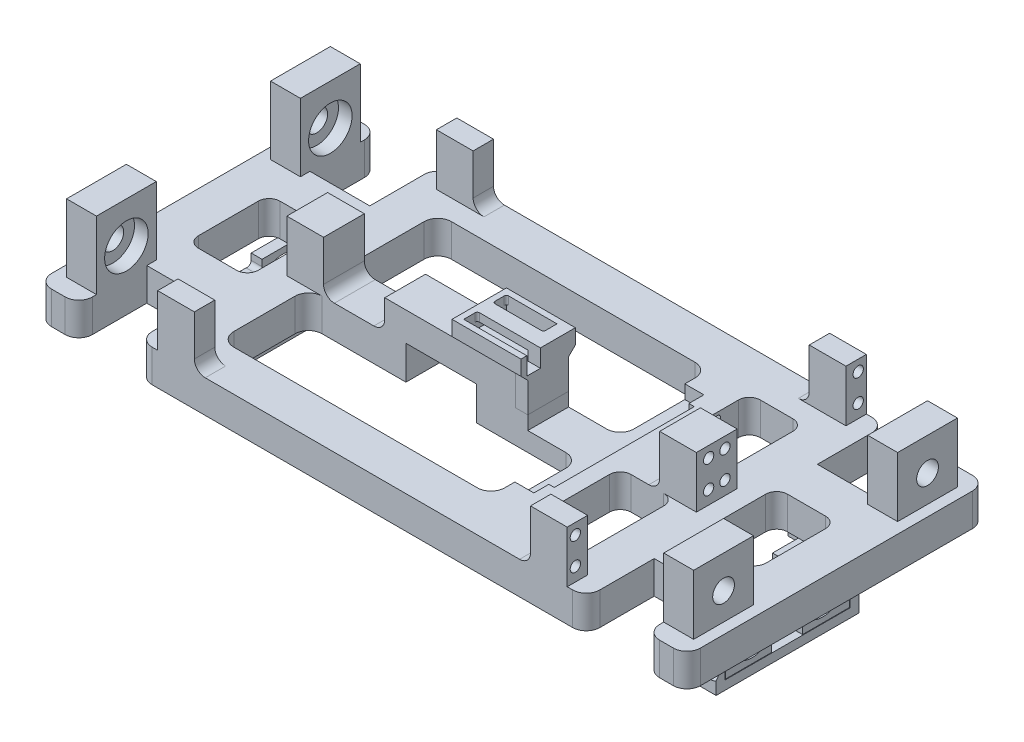
from build123d import *

# Parameters (mm, degrees)
SKETCH1_W             = 134.6
SKETCH1_H             = 32.5
BOSS_EXTRUDE1_DEPTH   = 12
SKETCH2_W             = 12
SKETCH2_H             = 7.5
BOSS_EXTRUDE2_DEPTH   = 19
SKETCH3_R             = 1.9
CUT_EXTRUDE1_DEPTH    = 205.585336718
SKETCH4_W             = 22
SKETCH4_H             = 22
SKETCH4_R             = 8
BOSS_EXTRUDE3_DEPTH   = 5
BOSS_EXTRUDE3_2_DEPTH = 5
SKETCH6_W             = 22
SKETCH6_H             = 22
SKETCH6_R             = 4
BOSS_EXTRUDE4_DEPTH   = 6
SKETCH7_W             = 22
SKETCH7_H             = 15
BOSS_EXTRUDE5_DEPTH   = 12
SKETCH8_W             = 22
SKETCH8_H             = 30
CUT_EXTRUDE2_DEPTH    = 134.197184655
SKETCH14_W            = 15
SKETCH14_H            = 32.5
BOSS_EXTRUDE8_DEPTH   = 12
SKETCH16_W            = 15
SKETCH16_H            = 32.5
CUT_EXTRUDE8_DEPTH    = 134.197184655
SKETCH17_W            = 15
SKETCH17_H            = 32.5
BOSS_EXTRUDE9_DEPTH   = 12
SKETCH15_W            = 26
SKETCH15_H            = 62.5
CUT_EXTRUDE9_DEPTH    = 5
CUT_EXTRUDE10_REACH   = 173.275
SKETCH18_R            = 1.2
SKETCH19_W            = 51.5
SKETCH19_H            = 7
CUT_EXTRUDE11_DEPTH   = 2
BOSS_EXTRUDE10_DEPTH  = 15
SKETCH22_W            = 4.6
SKETCH22_H            = 11
BOSS_EXTRUDE11_DEPTH  = 15
BOSS_EXTRUDE12_DEPTH  = 4.6
BOSS_EXTRUDE13_DEPTH  = 18.6
SKETCH29_W            = 20
SKETCH29_H            = 5.5
BOSS_EXTRUDE14_DEPTH  = 2.15
CUT_EXTRUDE12_DEPTH   = 135.318613751
SKETCH41_W            = 3
SKETCH41_H            = 3.5
SKETCH41_H_2          = 7.75
SKETCH41_H_3          = 30
BOSS_EXTRUDE18_DEPTH  = 24
BOSS_EXTRUDE19_DEPTH  = 8
SKETCH44_W            = 7.5
SKETCH44_H            = 5
BOSS_EXTRUDE20_DEPTH  = 7.5
SKETCH45_R            = 2.75
CUT_EXTRUDE20_DEPTH   = 3
SKETCH47_R            = 1.4
CUT_EXTRUDE22_DEPTH   = 10
BOSS_EXTRUDE22_START  = 5
SKETCH48_R            = 8.1
BOSS_EXTRUDE22_DEPTH  = 4
SKETCH50_W            = 26
SKETCH50_H            = 2.2
SKETCH50_H_2          = 12.8
CUT_EXTRUDE23_DEPTH   = 11
SKETCH53_R            = 1.4
CUT_EXTRUDE26_DEPTH   = 8.6
SKETCH55_W            = 1.5
SKETCH55_H            = 7.5
SKETCH55_H_2          = 15
BOSS_EXTRUDE27_DEPTH  = 19
CUT_EXTRUDE27_DEPTH   = 3
SKETCH56_R            = 1.45
CUT_EXTRUDE28_DEPTH   = 5
SKETCH57_R            = 1.45
CUT_EXTRUDE29_DEPTH   = 5
CHAMFER1_SIZE         = 2
SKETCH58_R            = 1.4
CUT_EXTRUDE30_DEPTH   = 10
SKETCH59_W            = 26
SKETCH59_H            = 2.2
CUT_EXTRUDE31_DEPTH   = 1.4
SKETCH60_W            = 11
SKETCH60_H            = 22
BOSS_EXTRUDE28_DEPTH  = 3
SKETCH62_R            = 1.825
CUT_EXTRUDE33_DEPTH   = 9
FILLET2_R             = 4
FILLET4_R             = 5
SKETCH64_W            = 4.6
SKETCH64_H            = 5
CUT_EXTRUDE34_DEPTH   = 3.5


with BuildPart() as part:
    # Sketch1 → Boss-Extrude1 (new body)
    with BuildSketch(Plane(origin=(0, 0, 0), x_dir=(1, 0, 0), z_dir=(0, 1, 0))):
        Polygon((-104.3, -55), (-104.3, -7.5), (-82.3, -7.5), (-82.3, -55), (82.3, -55), (82.3, -7.5), (104.3, -7.5), (104.3, -55), (119.3, -55), (119.3, 55), (104.3, 55), (104.3, 7.5), (82.3, 7.5), (82.3, 55), (-82.3, 55), (-82.3, 7.5), (-104.3, 7.5), (-104.3, 55), (-119.3, 55), (-119.3, -55), align=None)
        with Locations((0, -23.75)):
            Rectangle(SKETCH1_W, SKETCH1_H, mode=Mode.SUBTRACT)
        with Locations((0, 23.75)):
            Rectangle(SKETCH1_W, SKETCH1_H, mode=Mode.SUBTRACT)
    extrude(amount=BOSS_EXTRUDE1_DEPTH)

    # Sketch2 → Boss-Extrude2 (add)
    with BuildSketch(Plane(origin=(0, 12, 0), x_dir=(1, 0, 0), z_dir=(0, 1, 0))):
        with Locations((-69.3, 51.25)):
            Rectangle(SKETCH2_W, SKETCH2_H)
        Polygon((-75.3, 7.5), (-63.3, 7.5), (-63.3, 0), (-63.3, -7.5), (-75.3, -7.5), (-75.3, 0), align=None)
        with Locations((-69.3, -51.25)):
            Rectangle(SKETCH2_W, SKETCH2_H)
        with Locations((69.3, -51.25)):
            Rectangle(SKETCH2_W, SKETCH2_H)
        Polygon((75.3, 7.5), (75.3, 0), (75.3, -7.5), (63.3, -7.5), (63.3, 0), (63.3, 7.5), align=None)
        with Locations((69.3, 51.25)):
            Rectangle(SKETCH2_W, SKETCH2_H)
    extrude(amount=BOSS_EXTRUDE2_DEPTH)

    # Sketch3 → Cut-Extrude1 (cut, through all)
    with BuildSketch(Plane.ZY.offset(75.3)):
        with Locations((-52, 17)):
            Circle(SKETCH3_R)
        with Locations((-52, 27)):
            Circle(SKETCH3_R)
        with Locations((-3, 17)):
            Circle(SKETCH3_R)
        with Locations((-3, 27)):
            Circle(SKETCH3_R)
        with Locations((3, 27)):
            Circle(SKETCH3_R)
        with Locations((3, 17)):
            Circle(SKETCH3_R)
        with Locations((52, 17)):
            Circle(SKETCH3_R)
        with Locations((52, 27)):
            Circle(SKETCH3_R)
    extrude(amount=-CUT_EXTRUDE1_DEPTH, mode=Mode.SUBTRACT)



with BuildPart() as body_2:
    # Sketch4 → Boss-Extrude3 (new body)
    with BuildSketch(Plane.ZY.offset(-104.3)):
        with Locations((-37.5, 23)):
            Rectangle(SKETCH4_W, SKETCH4_H)
        with Locations(Location((-37.5, 22, 0), (0, 0, 180))):
            Circle(SKETCH4_R, mode=Mode.SUBTRACT)
    extrude(amount=-BOSS_EXTRUDE3_DEPTH)


with BuildPart() as body_3:
    # Sketch4 → Boss-Extrude3 2 (new body)
    with BuildSketch(Plane.ZY.offset(-104.3)):
        with Locations((37.5, 23)):
            Rectangle(SKETCH4_W, SKETCH4_H)
        with Locations((37.5, 22)):
            Circle(SKETCH4_R, mode=Mode.SUBTRACT)
    extrude(amount=-BOSS_EXTRUDE3_2_DEPTH)


    add(body_2.part)  # Boss-Extrude4 merges body 2
    # Sketch6 → Boss-Extrude4 (add)
    # profile 1 of 2: a face of its own
    with BuildSketch(Plane(origin=(109.3, 0, 0), x_dir=(0, 0, -1), z_dir=(1, 0, 0))):
        with Locations((-37.5, 23)):
            Rectangle(SKETCH6_W, SKETCH6_H)
        with Locations((-37.5, 22)):
            Circle(SKETCH6_R, mode=Mode.SUBTRACT)
    # profile 2 of 2: a face of its own
    with BuildSketch(Plane(origin=(109.3, 0, 0), x_dir=(0, 0, -1), z_dir=(1, 0, 0))):
        with Locations((37.5, 23)):
            Rectangle(SKETCH6_W, SKETCH6_H)
        with Locations((37.5, 22)):
            Circle(SKETCH6_R, mode=Mode.SUBTRACT)
    extrude(amount=BOSS_EXTRUDE4_DEPTH)


with BuildPart() as body_3_2:
    # Mirror1: mirrored copy
    add(body_3.part.mirror(Plane(origin=(0, 0, 0), x_dir=(0, 0, 1), z_dir=(1, 0, 0))))


with BuildPart() as part_1:
    add(part.part)

    add(body_3.part)  # Boss-Extrude5 merges body 3

    add(body_3_2.part)  # Boss-Extrude5 merges body 3 2
    # Sketch7 → Boss-Extrude5 (add)
    with BuildSketch(Plane(origin=(0, 0, 0), x_dir=(1, 0, 0), z_dir=(0, 1, 0))):
        with Locations((-93.3, 22.5)):
            Rectangle(SKETCH7_W, SKETCH7_H)
        with Locations((93.3, 22.5)):
            Rectangle(SKETCH7_W, SKETCH7_H)
        with Locations((93.3, -22.5)):
            Rectangle(SKETCH7_W, SKETCH7_H)
        with Locations((-93.3, -22.5)):
            Rectangle(SKETCH7_W, SKETCH7_H)
    extrude(amount=BOSS_EXTRUDE5_DEPTH)

    # Sketch8 → Cut-Extrude2 (cut, through all)
    with BuildSketch(Plane(origin=(0, 12, 0), x_dir=(1, 0, 0), z_dir=(0, 1, 0))):
        with Locations((-93.3, 0)):
            Rectangle(SKETCH8_W, SKETCH8_H)
        with Locations((93.3, 0)):
            Rectangle(SKETCH8_W, SKETCH8_H)
    extrude(amount=-CUT_EXTRUDE2_DEPTH, mode=Mode.SUBTRACT)

    # Sketch14 → Boss-Extrude8 (add)
    with BuildSketch(Plane(origin=(0, 0, 0), x_dir=(1, 0, 0), z_dir=(0, 1, 0))):
        with Locations((0, -23.75)):
            Rectangle(SKETCH14_W, SKETCH14_H)
        with Locations((0, 23.75)):
            Rectangle(SKETCH14_W, SKETCH14_H)
    extrude(amount=BOSS_EXTRUDE8_DEPTH)

    # Sketch16 → Cut-Extrude8 (cut, through all)
    with BuildSketch(Plane(origin=(0, 12, 0), x_dir=(1, 0, 0), z_dir=(0, 1, 0))):
        with Locations((0, 23.75)):
            Rectangle(SKETCH16_W, SKETCH16_H)
        with Locations((0, -23.75)):
            Rectangle(SKETCH16_W, SKETCH16_H)
    extrude(amount=-CUT_EXTRUDE8_DEPTH, mode=Mode.SUBTRACT)

    # Sketch17 → Boss-Extrude9 (add)
    with BuildSketch(Plane(origin=(0, 0, 0), x_dir=(1, 0, 0), z_dir=(0, 1, 0))):
        with Locations((39.800000001, 23.75)):
            Rectangle(SKETCH17_W, SKETCH17_H)
        with Locations((39.800000001, -23.75)):
            Rectangle(SKETCH17_W, SKETCH17_H)
    extrude(amount=BOSS_EXTRUDE9_DEPTH)

    # Sketch15 → Cut-Extrude9 (cut)
    with BuildSketch(Plane(origin=(0, 12, 0), x_dir=(1, 0, 0), z_dir=(0, 1, 0))):
        with Locations((26.3, 0)):
            Rectangle(SKETCH15_W, SKETCH15_H)
    extrude(amount=-CUT_EXTRUDE9_DEPTH, mode=Mode.SUBTRACT)

    # Sketch18 → Cut-Extrude10 (cut, up to next)
    with BuildSketch(Plane.ZY.offset(-39.3), mode=Mode.PRIVATE) as cut_extrude10_sk1:
        with Locations((28.25, 9.7)):
            Circle(SKETCH18_R)
    cut_extrude10_tool1 = extrude(cut_extrude10_sk1.sketch, amount=-CUT_EXTRUDE10_REACH, mode=Mode.PRIVATE) & part_1.part
    # Sketch18 → Cut-Extrude10 (cut, up to next)
    with BuildSketch(Plane.ZY.offset(-39.3), mode=Mode.PRIVATE) as cut_extrude10_sk2:
        with Locations((-28.25, 9.7)):
            Circle(SKETCH18_R)
    cut_extrude10_tool2 = extrude(cut_extrude10_sk2.sketch, amount=-CUT_EXTRUDE10_REACH, mode=Mode.PRIVATE) & part_1.part
    add(cut_extrude10_tool1.solids().sort_by_distance((39.3, 9.7, 28.25))[0], mode=Mode.SUBTRACT)
    add(cut_extrude10_tool2.solids().sort_by_distance((39.3, 9.7, -28.25))[0], mode=Mode.SUBTRACT)

    # Sketch19 → Cut-Extrude11 (cut)
    with BuildSketch(Plane.ZY.offset(-39.3)):
        with Locations((0, 10.5)):
            Rectangle(SKETCH19_W, SKETCH19_H)
    extrude(amount=-CUT_EXTRUDE11_DEPTH, mode=Mode.SUBTRACT)

    # Sketch21 → Boss-Extrude10 (add)
    with BuildSketch(Plane.XY.offset(7.5)):
        Polygon((-39.3, 12), (2.349147039, 12), (8.7, 12), (8.7, 23), (-39.3, 23), align=None)
    extrude(amount=-BOSS_EXTRUDE10_DEPTH)


with BuildPart() as body_2_2:
    # Sketch22 → Boss-Extrude11 (new body)
    with BuildSketch(Plane.XY.offset(7.5)):
        with Locations((11, 17.5)):
            Rectangle(SKETCH22_W, SKETCH22_H)
    extrude(amount=-BOSS_EXTRUDE11_DEPTH)

    # Sketch25 → Boss-Extrude12 (add)
    with BuildSketch(Plane(origin=(13.3, 0, 0), x_dir=(0, 0, -1), z_dir=(1, 0, 0))):
        Polygon((-7.5, 23), (7.5, 23), (10, 25.5), (10, 31), (-10, 31), (-10, 25.5), align=None)
    extrude(amount=-BOSS_EXTRUDE12_DEPTH)

    # Sketch28 → Boss-Extrude13 (add)
    with BuildSketch(Plane.ZY.offset(-8.7)):
        Polygon((-10, 31), (10, 31), (10, 25.5), (7.85, 25.5), (7.85, 28), (-7.85, 28), (-7.85, 25.5), (-10, 25.5), align=None)
    extrude(amount=BOSS_EXTRUDE13_DEPTH)

    # Sketch29 → Boss-Extrude14 (add)
    with BuildSketch(Plane.ZY.offset(9.9)):
        with Locations((0, 28.25)):
            Rectangle(SKETCH29_W, SKETCH29_H)
    extrude(amount=BOSS_EXTRUDE14_DEPTH)

    # Sketch31 → Cut-Extrude12 (cut, through all)
    with BuildSketch(Plane.XZ.offset(-28)):
        with BuildLine():
            ThreePointArc((-9.9, 3.65), (-9.665685425, 3.084314575), (-9.1, 2.85))
            Line((-9.1, 2.85), (13.3, 2.85))
            Line((13.3, 2.85), (13.3, 7.85))
            Line((13.3, 7.85), (-9.9, 7.85))
            Line((-9.9, 7.85), (-9.9, 3.65))
        make_face()
        with BuildLine():
            ThreePointArc((8.7, -3.65), (8.465685425, -3.084314575), (7.9, -2.85))
            Line((7.9, -2.85), (-9.1, -2.85))
            ThreePointArc((-9.1, -2.85), (-9.665685425, -3.084314575), (-9.9, -3.65))
            Line((-9.9, -3.65), (-9.9, -7.05))
            ThreePointArc((-9.9, -7.05), (-9.665685425, -7.615685425), (-9.1, -7.85))
            Line((-9.1, -7.85), (8.7, -7.85))
            Line((8.7, -7.85), (8.7, -3.65))
        make_face()
    extrude(amount=-CUT_EXTRUDE12_DEPTH, mode=Mode.SUBTRACT)

    # Sketch64 → Cut-Extrude34 (cut)
    with BuildSketch(Plane(origin=(0, 28, 0), x_dir=(1, 0, 0), z_dir=(0, 1, 0))):
        with Locations((11, -5.35)):
            Rectangle(SKETCH64_W, SKETCH64_H)
    extrude(amount=-CUT_EXTRUDE34_DEPTH, mode=Mode.SUBTRACT)


with BuildPart() as body_3_3:
    # Sketch41 → Boss-Extrude18 (new body)
    with BuildSketch(Plane.XZ):
        with Locations((91.8, 24.5)):
            Rectangle(SKETCH41_W, SKETCH41_H)
        with Locations((91.8, 18.875)):
            Rectangle(SKETCH41_W, SKETCH41_H_2)
        with Locations((91.8, 0)):
            Rectangle(SKETCH41_W, SKETCH41_H_3)
        with Locations((91.8, -18.875)):
            Rectangle(SKETCH41_W, SKETCH41_H_2)
        with Locations((91.8, -24.5)):
            Rectangle(SKETCH41_W, SKETCH41_H)
    extrude(amount=BOSS_EXTRUDE18_DEPTH)

    # Sketch42 → Boss-Extrude19 (add)
    with BuildSketch(Plane(origin=(93.3, 0, 0), x_dir=(0, 0, -1), z_dir=(1, 0, 0))):
        Polygon((-22.95, 0), (-26.25, 0), (-26.25, -24), (26.25, -24), (26.25, 0), (22.95, 0), (22.95, -20.7), (-22.95, -20.7), align=None)
    extrude(amount=BOSS_EXTRUDE19_DEPTH)

    # Sketch44 → Boss-Extrude20 (add)
    with BuildSketch(Plane.ZY.offset(-90.3)):
        with Locations((-22.5, -2.5)):
            Rectangle(SKETCH44_W, SKETCH44_H)
        with Locations((22.5, -2.5)):
            Rectangle(SKETCH44_W, SKETCH44_H)
    extrude(amount=BOSS_EXTRUDE20_DEPTH)

    # Sketch45 → Cut-Extrude20 (cut)
    with BuildSketch(Plane.XZ.offset(5)):
        with Locations(Location((86.55, 22.5, 0), (0, 0, 270))):
            Circle(SKETCH45_R)
        with Locations(Location((86.55, -22.5, 0), (0, 0, 270))):
            Circle(SKETCH45_R)
    extrude(amount=-CUT_EXTRUDE20_DEPTH, mode=Mode.SUBTRACT)


with BuildPart() as cut_extrude22_tool:
    # Sketch47 → Cut-Extrude22 (new body)
    with BuildSketch(Plane.XZ.offset(2)):
        with Locations(Location((86.55, -22.5, 0), (0, 0, 270))):
            Circle(SKETCH47_R)
        with Locations(Location((86.55, 22.5, 0), (0, 0, 270))):
            Circle(SKETCH47_R)
    extrude(amount=-CUT_EXTRUDE22_DEPTH)


with BuildPart() as part_2:
    add(part_1.part)

    # Cut-Extrude22: cut by cut_extrude22_tool
    add(cut_extrude22_tool.part, mode=Mode.SUBTRACT)

    # Sketch50 → Cut-Extrude23 (cut)
    with BuildSketch(Plane.XZ):
        with Locations((-18.5, 6.4)):
            Rectangle(SKETCH50_W, SKETCH50_H)
        with Locations((-18.5, -1.1)):
            Rectangle(SKETCH50_W, SKETCH50_H_2)
    extrude(amount=-CUT_EXTRUDE23_DEPTH, mode=Mode.SUBTRACT)

    # Sketch53 → Cut-Extrude26 (cut)
    with BuildSketch(Plane.XZ.offset(-11)):
        with Locations(Location((-29, -5, 0), (0, 0, 270))):
            Circle(SKETCH53_R)
        with Locations(Location((-8, -5, 0), (0, 0, 270))):
            Circle(SKETCH53_R)
    extrude(amount=-CUT_EXTRUDE26_DEPTH, mode=Mode.SUBTRACT)

    # Sketch55 → Boss-Extrude27 (add)
    with BuildSketch(Plane(origin=(0, 12, 0), x_dir=(1, 0, 0), z_dir=(0, 1, 0))):
        with Locations((-62.55, 51.25)):
            Rectangle(SKETCH55_W, SKETCH55_H)
        with Locations((62.55, 51.25)):
            Rectangle(SKETCH55_W, SKETCH55_H)
        with Locations((62.55, 0)):
            Rectangle(SKETCH55_W, SKETCH55_H_2)
        with Locations((62.55, -51.25)):
            Rectangle(SKETCH55_W, SKETCH55_H)
        with Locations((-62.55, -51.25)):
            Rectangle(SKETCH55_W, SKETCH55_H)
        with Locations((-62.55, 0)):
            Rectangle(SKETCH55_W, SKETCH55_H_2)
    extrude(amount=BOSS_EXTRUDE27_DEPTH)

    # Sketch58 → Cut-Extrude30 (cut)
    with BuildSketch(Plane.XZ.offset(2)):
        with Locations(Location((-86.55, 22.5, 0), (0, 0, 270))):
            Circle(SKETCH58_R)
        with Locations(Location((-86.55, -22.5, 0), (0, 0, 270))):
            Circle(SKETCH58_R)
    extrude(amount=-CUT_EXTRUDE30_DEPTH, mode=Mode.SUBTRACT)

    # Sketch59 → Cut-Extrude31 (cut)
    with BuildSketch(Plane.XZ.offset(-11)):
        with Locations((-18.5, 6.4)):
            Rectangle(SKETCH59_W, SKETCH59_H)
    extrude(amount=-CUT_EXTRUDE31_DEPTH, mode=Mode.SUBTRACT)

    # Sketch60 → Boss-Extrude28 (add)
    with BuildSketch(Plane(origin=(0, 34, 0), x_dir=(1, 0, 0), z_dir=(0, 1, 0))):
        with Locations((-109.8, 37.5)):
            Rectangle(SKETCH60_W, SKETCH60_H)
        with Locations((-109.8, -37.5)):
            Rectangle(SKETCH60_W, SKETCH60_H)
    extrude(amount=BOSS_EXTRUDE28_DEPTH)

    # Sketch62 → Cut-Extrude33 (cut)
    with BuildSketch(Plane.XZ):
        with Locations(Location((-74.8, 25, 0), (0, 0, 270))):
            Circle(SKETCH62_R)
        with Locations(Location((-74.8, -25, 0), (0, 0, 270))):
            Circle(SKETCH62_R)
        with Locations(Location((-74.8, -47.5, 0), (0, 0, 270))):
            Circle(SKETCH62_R)
        with Locations(Location((-74.8, 47.5, 0), (0, 0, 270))):
            Circle(SKETCH62_R)
        with Locations(Location((0, 47.5, 0), (0, 0, 270))):
            Circle(SKETCH62_R)
        with Locations(Location((0, -47.5, 0), (0, 0, 270))):
            Circle(SKETCH62_R)
        with Locations(Location((74.8, -47.5, 0), (0, 0, 90))):
            Circle(SKETCH62_R)
        with Locations(Location((74.8, -25, 0), (0, 0, 90))):
            Circle(SKETCH62_R)
        with Locations(Location((74.8, 25, 0), (0, 0, 90))):
            Circle(SKETCH62_R)
        with Locations(Location((74.8, 47.5, 0), (0, 0, 90))):
            Circle(SKETCH62_R)
    extrude(amount=-CUT_EXTRUDE33_DEPTH, mode=Mode.SUBTRACT)

    # Fillet2
    fillet2_edges = [part_2.edges().sort_by_distance(p)[0] for p in [
        (-104.3, 6, -15),
        (-82.3, 6, -15),
        (82.3, 6, -15),
        (104.3, 6, -15),
        (104.3, 6, 15),
        (82.3, 6, 15),
        (-82.3, 6, 15),
        (-104.3, 6, 15),
        (47.300000001, 6, -40),
        (47.300000001, 6, -7.5),
        (47.300000001, 6, 7.5),
        (47.300000001, 6, 40),
        (67.3, 6, -7.5),
        (67.3, 6, -40),
        (-39.3, 12, 0),
        (-61.8, 12, -51.25),
        (61.8, 12, -51.25),
        (67.3, 6, 7.5),
        (61.8, 12, 0),
        (61.8, 12, 51.25),
        (-61.8, 12, 51.25),
        (-61.8, 12, 0),
    ]]
    fillet(fillet2_edges, radius=FILLET2_R)

    # Fillet4
    fillet4_edges = [part_2.edges().sort_by_distance(p)[0] for p in [
        (-119.3, 6, -55),
        (-104.3, 6, -55),
        (-82.3, 6, -55),
        (82.3, 6, -55),
        (104.3, 6, -55),
        (119.3, 6, -55),
        (119.3, 6, 55),
        (104.3, 6, 55),
        (82.3, 6, 55),
        (-82.3, 6, 55),
        (-104.3, 6, 55),
        (-119.3, 6, 55),
        (32.300000001, 6, -40),
        (32.300000001, 6, 40),
        (32.300000001, 3.5, 7.5),
        (32.300000001, 3.5, -7.5),
        (-67.3, 6, -40),
        (-67.3, 6, -7.5),
        (-67.3, 6, 40),
        (-67.3, 6, 7.5),
    ]]
    fillet(fillet4_edges, radius=FILLET4_R)


with BuildPart() as body_3_3_1:
    add(body_3_3.part)

    # Cut-Extrude22: cut by cut_extrude22_tool
    add(cut_extrude22_tool.part, mode=Mode.SUBTRACT)

    # Sketch42<4> → Cut-Extrude27 (cut)
    with BuildSketch(Plane(origin=(93.3, 0, 0), x_dir=(0, 0, -1), z_dir=(1, 0, 0))):
        Polygon((5.5, 0), (-5.5, 0), (-5.5, -3.3), (-5.5, -3.5), (5.5, -3.5), (5.5, -3.3), align=None)
    extrude(amount=-CUT_EXTRUDE27_DEPTH, mode=Mode.SUBTRACT)


with BuildPart() as body_4:
    # Sketch48 → Boss-Extrude22 (new body)
    with BuildSketch(Plane(origin=(93.3, 0, 0), x_dir=(0, 0, -1), z_dir=(1, 0, 0)).offset(BOSS_EXTRUDE22_START)):
        with BuildLine():
            Line((-5, -2.5), (-5, -0.2))
            Line((-5, -0.2), (-22.75, -0.2))
            Line((-22.75, -0.2), (-22.75, -20.5))
            Line((-22.75, -20.5), (-5.95, -20.5))
            Line((-5.95, -20.5), (-5.95, -17.7))
            ThreePointArc((-5.95, -17.7), (-5.305634919, -16.144365081), (-3.75, -15.5))
            Line((-3.75, -15.5), (3.35, -15.5))
            ThreePointArc((3.35, -15.5), (4.905634919, -16.144365081), (5.55, -17.7))
            Line((5.55, -17.7), (5.55, -20.5))
            Line((5.55, -20.5), (22.75, -20.5))
            Line((22.75, -20.5), (22.75, -0.2))
            Line((22.75, -0.2), (5.37887841, -0.2))
            Line((5.37887841, -0.2), (5.37887841, -2.548638174))
            ThreePointArc((5.37887841, -2.548638174), (4.795852342, -3.735718124), (3.5, -4))
            Line((3.5, -4), (-3.5, -4))
            ThreePointArc((-3.5, -4), (-4.560660172, -3.560660172), (-5, -2.5))
        make_face()
        with Locations((-13, -10.5)):
            Circle(SKETCH48_R, mode=Mode.SUBTRACT)
        with Locations((13, -10.5)):
            Circle(SKETCH48_R, mode=Mode.SUBTRACT)
    extrude(amount=BOSS_EXTRUDE22_DEPTH)


with BuildPart() as body_4_1:
    # Body-Move/Copy1: moved
    add(body_4.part.moved(Location((-1, 0, 0))))


with BuildPart() as cut_extrude28_tool:
    # Sketch56 → Cut-Extrude28 (new body)
    with BuildSketch(Plane.XY.offset(26.25)):
        with Locations((99.3, -16.5)):
            Circle(SKETCH56_R)
    extrude(amount=-CUT_EXTRUDE28_DEPTH)


with BuildPart() as body_3_3_2:
    add(body_3_3_1.part)

    # Cut-Extrude28: cut by cut_extrude28_tool
    add(cut_extrude28_tool.part, mode=Mode.SUBTRACT)


with BuildPart() as body_4_2:
    add(body_4_1.part)

    # Cut-Extrude28: cut by cut_extrude28_tool
    add(cut_extrude28_tool.part, mode=Mode.SUBTRACT)


with BuildPart() as cut_extrude29_tool:
    # Sketch57 → Cut-Extrude29 (new body)
    with BuildSketch(Plane(origin=(0, 0, -26.25), x_dir=(-1, 0, 0), z_dir=(0, 0, -1))):
        with Locations((-99.3, -4.2)):
            Circle(SKETCH57_R)
    extrude(amount=-CUT_EXTRUDE29_DEPTH)


with BuildPart() as body_3_3_3:
    add(body_3_3_2.part)

    # Cut-Extrude29: cut by cut_extrude29_tool
    add(cut_extrude29_tool.part, mode=Mode.SUBTRACT)

    # Chamfer1
    # the kernel refuses this chamfer: 2 mm, written as the material it takes off along each edge
    with BuildSketch(Plane(origin=(99.3, -16.5, 26.25), x_dir=(1, 0, 0), z_dir=(0, -1, 0))) as chamfer1_piece_1:
        Polygon((1.45 + CHAMFER1_SIZE, 0), (1.45, -CHAMFER1_SIZE), (1.45, 0), align=None)
    revolve(axis=Axis((99.3, -16.5, 26.25), (0, 0, 1)), mode=Mode.SUBTRACT)
    with BuildSketch(Plane(origin=(99.3, -4.2, -26.25), x_dir=(-1, 0, 0), z_dir=(0, -1, 0))) as chamfer1_piece_2:
        Polygon((1.45 + CHAMFER1_SIZE, 0), (1.45, -CHAMFER1_SIZE), (1.45, 0), align=None)
    revolve(axis=Axis((99.3, -4.2, -26.25), (0, 0, -1)), mode=Mode.SUBTRACT)


with BuildPart() as body_4_3:
    add(body_4_2.part)

    # Cut-Extrude29: cut by cut_extrude29_tool
    add(cut_extrude29_tool.part, mode=Mode.SUBTRACT)


with BuildPart() as body_5:
    # Mirror6: mirrored copy
    add(body_3_3_3.part.mirror(Plane(origin=(0, 0, 0), x_dir=(0, 0, 1), z_dir=(1, 0, 0))))


with BuildPart() as body_6:
    # Mirror6 2: mirrored copy
    add(body_4_3.part.mirror(Plane(origin=(0, 0, 0), x_dir=(0, 0, 1), z_dir=(1, 0, 0))))


solid = Compound([body_2_2.part, part_2.part, body_3_3_3.part, body_4_3.part, body_5.part, body_6.part])
